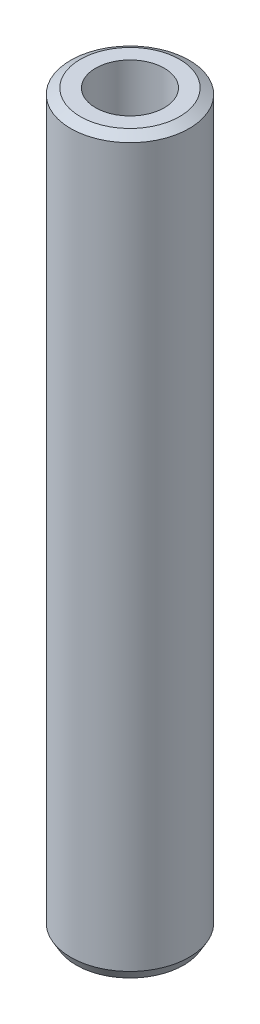
from build123d import *
from OCP.BRepFilletAPI import BRepFilletAPI_MakeChamfer

# Parameters (mm, degrees)
SKETCH1_R           = 40
BOSS_EXTRUDE1_DEPTH = 494.948348474
SKETCH2_R           = 23.186449738
CUT_EXTRUDE1_DEPTH  = 499.170520663
CHAMFER1_SIZE       = 3.738409533
CHAMFER1_SIZE2      = 6.475115251


with BuildPart() as part:
    # Sketch1 → Boss-Extrude1 (new body)
    with BuildSketch(Plane(origin=(0, 0, 0), x_dir=(1, 0, 0), z_dir=(0, 1, 0))):
        Circle(SKETCH1_R)
    extrude(amount=BOSS_EXTRUDE1_DEPTH)

    # Sketch2 → Cut-Extrude1 (cut, through all)
    with BuildSketch(Plane(origin=(0, 0, 0), x_dir=(1, 0, 0), z_dir=(0, 1, 0))):
        Circle(SKETCH2_R)
    extrude(amount=CUT_EXTRUDE1_DEPTH, mode=Mode.SUBTRACT)

    # Chamfer1: one chamfer whose edges measure the first distance from different faces: ONE call of the kernel's chamfer builder (chamfer() names one face for all edges)
    chamfer1_edges_1 = [part.edges().sort_by_distance(p)[0] for p in [
        (-40, 494.948348474, 0),
    ]]
    chamfer1_side_1 = [part.faces().sort_by_distance(p)[0] for p in [
        (-40, 247.474174237, 0),
    ]]
    chamfer1_edges_2 = [part.edges().sort_by_distance(p)[0] for p in [
        (-40, 0, 0),
    ]]
    chamfer1_side_2 = [part.faces().sort_by_distance(p)[0] for p in [
        (-38.86862915, 0, 0),
    ]]
    chamfer1 = BRepFilletAPI_MakeChamfer(part.part.solid().wrapped)
    for e in chamfer1_edges_1:
        chamfer1.Add(CHAMFER1_SIZE, CHAMFER1_SIZE2, e.wrapped, chamfer1_side_1[0].wrapped)  # the first distance lies on this face
    for e in chamfer1_edges_2:
        chamfer1.Add(CHAMFER1_SIZE, CHAMFER1_SIZE2, e.wrapped, chamfer1_side_2[0].wrapped)  # the first distance lies on this face
    add(Compound.cast(chamfer1.Shape()), mode=Mode.REPLACE)


solid = part.part
